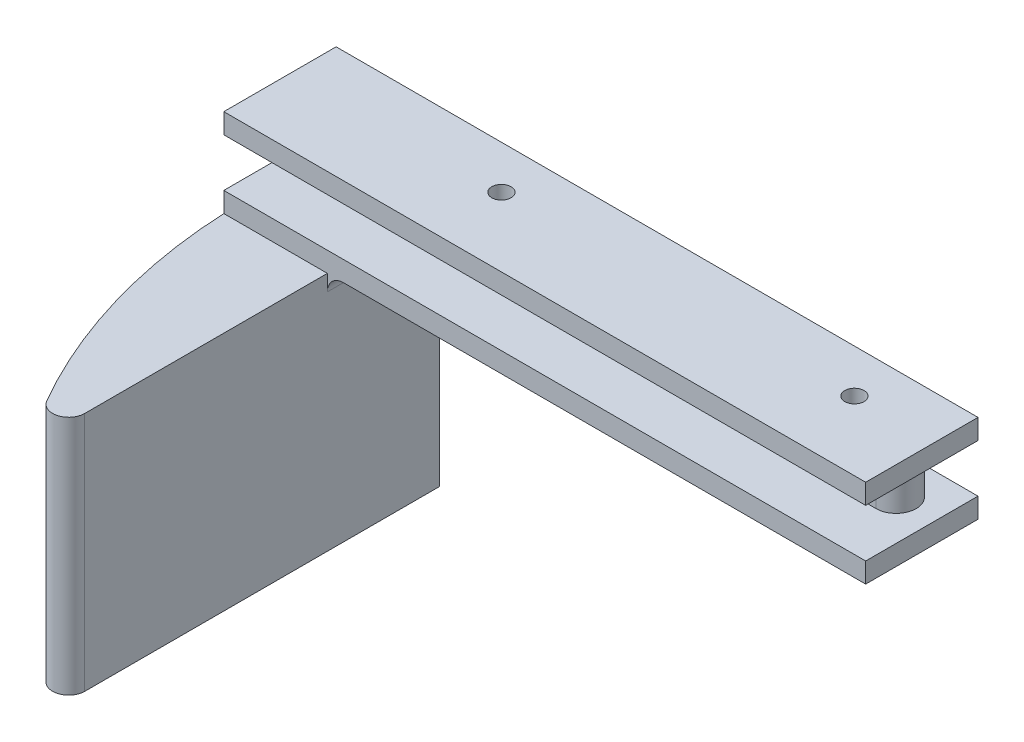
from build123d import *

# Parameters (mm, degrees)
SKETCH2_W           = 101.6
SKETCH2_H           = 17.78
BOSS_EXTRUDE1_DEPTH = 3.175
BOSS_EXTRUDE2_DEPTH = 7.62
BOSS_EXTRUDE3_DEPTH = 38.1
FILLET1_R           = 2.54
FILLET2_R           = 2.54
SKETCH5_R           = 1.524
CUT_EXTRUDE1_DEPTH  = 116.977489679


with BuildPart() as part:
    # Sketch2 → Boss-Extrude1 (new body)
    with BuildSketch(Plane(origin=(0, 0, 0), x_dir=(1, 0, 0), z_dir=(0, 1, 0))):
        with Locations((50.8, 8.89)):
            Rectangle(SKETCH2_W, SKETCH2_H)
    boss_extrude1 = extrude(amount=BOSS_EXTRUDE1_DEPTH)

    # Sketch3 → Boss-Extrude2 (add)
    with BuildSketch(Plane.XZ):
        with BuildLine():
            Line((95.25, -14.351), (6.35, -14.351))
            ThreePointArc((6.35, -14.351), (3.175, -11.176), (6.35, -8.001))
            Line((6.35, -8.001), (95.25, -8.001))
            ThreePointArc((95.25, -8.001), (98.425, -11.176), (95.25, -14.351))
        make_face()
    extrude(amount=BOSS_EXTRUDE2_DEPTH)

    # Mirror1: Boss-Extrude1 across plane
    add(boss_extrude1.mirror(Plane(origin=(0, -3.81, 0), x_dir=(0, 0, 1), z_dir=(0, -1, 0))))

    # Sketch4 → Boss-Extrude3 (add)
    with BuildSketch(Plane.XZ.offset(10.795)):
        with BuildLine():
            Line((0, -17.78), (16.393849753, -17.78))
            Line((16.393849753, -17.78), (16.393849753, 0))
            Line((16.393849753, 0), (16.393849753, 47.008966697))
            ThreePointArc((16.393849753, 47.008966697), (4.7870119, 24.693652244), (0, 0))
            Line((0, 0), (0, -17.78))
        make_face()
    extrude(amount=BOSS_EXTRUDE3_DEPTH)

    # Fillet1
    fillet1_edges = [part.edges().sort_by_distance(p)[0] for p in [
        (16.393849753, -10.795, -8.89),
    ]]
    fillet(fillet1_edges, radius=FILLET1_R)

    # Fillet2
    fillet2_edges = [part.edges().sort_by_distance(p)[0] for p in [
        (16.393849753, -29.845, 47.008966697),
    ]]
    fillet(fillet2_edges, radius=FILLET2_R)

    # Sketch5 → Cut-Extrude1 (cut, through all)
    with BuildSketch(Plane(origin=(0, -10.795, 0), x_dir=(-1, 0, 0), z_dir=(0, -1, 0))):
        with Locations((-88.9, 10.922)):
            Circle(SKETCH5_R)
        with Locations((-33.02, 10.922)):
            Circle(SKETCH5_R)
    extrude(amount=-CUT_EXTRUDE1_DEPTH, mode=Mode.SUBTRACT)


solid = part.part
